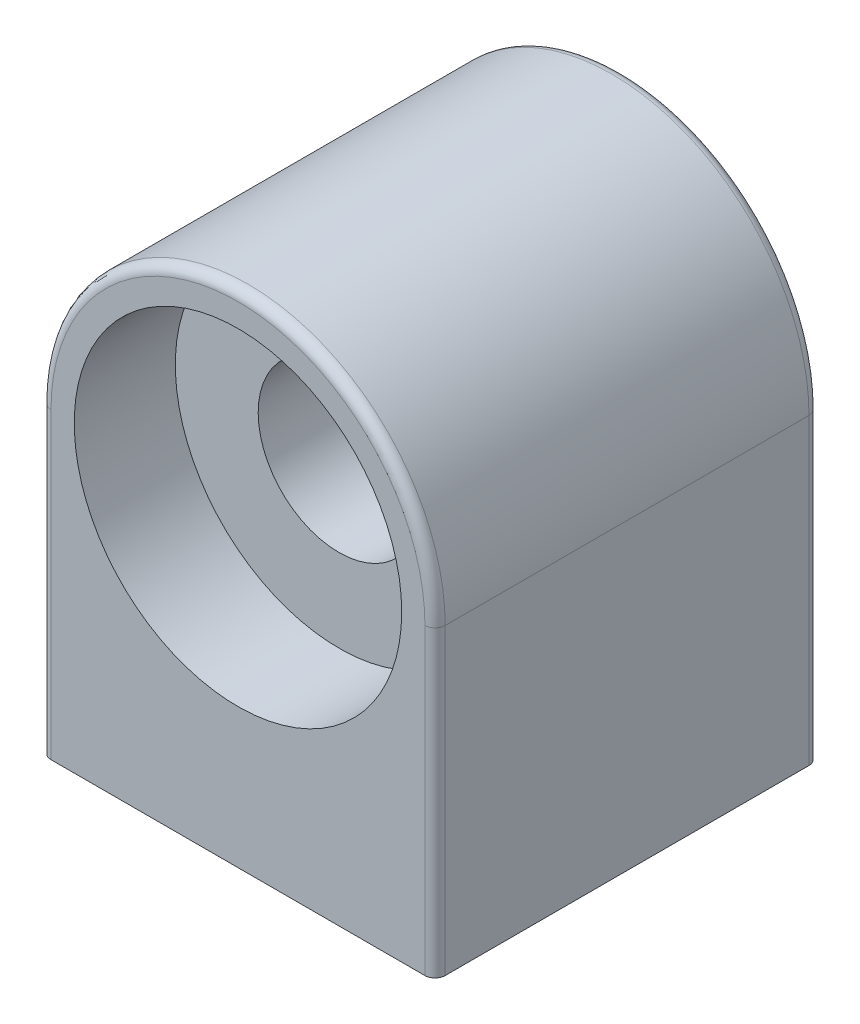
from build123d import *

# Parameters (mm, degrees)
BOSS_EXTRUDE2_DEPTH = 9.5
SKETCH4_R           = 4
CUT_EXTRUDE1_DEPTH  = 27.097174177
SKETCH9_R           = 8.1
CUT_EXTRUDE3_DEPTH  = 5
CUT_EXTRUDE4_START  = -5
SKETCH10_R          = 8.1
CUT_EXTRUDE4_DEPTH  = 5
SKETCH12_R          = 2.55
CUT_EXTRUDE6_DEPTH  = 8
FILLET1_R           = 0.5


with BuildPart() as part:
    # Sketch3 → Boss-Extrude2 (new, symmetric)
    with BuildSketch(Plane.XY):
        with BuildLine():
            Line((9.75, 0), (9.75, -15))
            Line((9.75, -15), (-9.75, -15))
            Line((-9.75, -15), (-9.75, 0))
            ThreePointArc((-9.75, 0), (0, 9.75), (9.75, 0))
        make_face()
    extrude(amount=BOSS_EXTRUDE2_DEPTH, both=True)

    # Sketch4 → Cut-Extrude1 (cut, through all)
    with BuildSketch(Plane(origin=(0, 0, -9.5), x_dir=(-1, 0, 0), z_dir=(0, 0, -1))):
        Circle(SKETCH4_R)
    extrude(amount=-CUT_EXTRUDE1_DEPTH, mode=Mode.SUBTRACT)

    # Sketch9 → Cut-Extrude3 (cut)
    with BuildSketch(Plane(origin=(0, 0, -9.5), x_dir=(-1, 0, 0), z_dir=(0, 0, -1))):
        Circle(SKETCH9_R)
    extrude(amount=-CUT_EXTRUDE3_DEPTH, mode=Mode.SUBTRACT)

    # Sketch10 → Cut-Extrude4 (cut)
    with BuildSketch(Plane.XY.offset(9.5).offset(CUT_EXTRUDE4_START)):
        Circle(SKETCH10_R)
    extrude(amount=CUT_EXTRUDE4_DEPTH, mode=Mode.SUBTRACT)

    # Sketch12 → Cut-Extrude6 (cut)
    with BuildSketch(Plane.XZ.offset(15)):
        Circle(SKETCH12_R)
    extrude(amount=-CUT_EXTRUDE6_DEPTH, mode=Mode.SUBTRACT)

    # Fillet1
    fillet1_edges = [part.edges().sort_by_distance(p)[0] for p in [
        (9.75, -7.5, -9.5),
        (0, 9.75, -9.5),
        (9.75, -7.5, 9.5),
        (0, 9.75, 9.5),
        (-9.75, -7.5, -9.5),
        (-9.75, -7.5, 9.5),
    ]]
    fillet(fillet1_edges, radius=FILLET1_R)


solid = part.part
